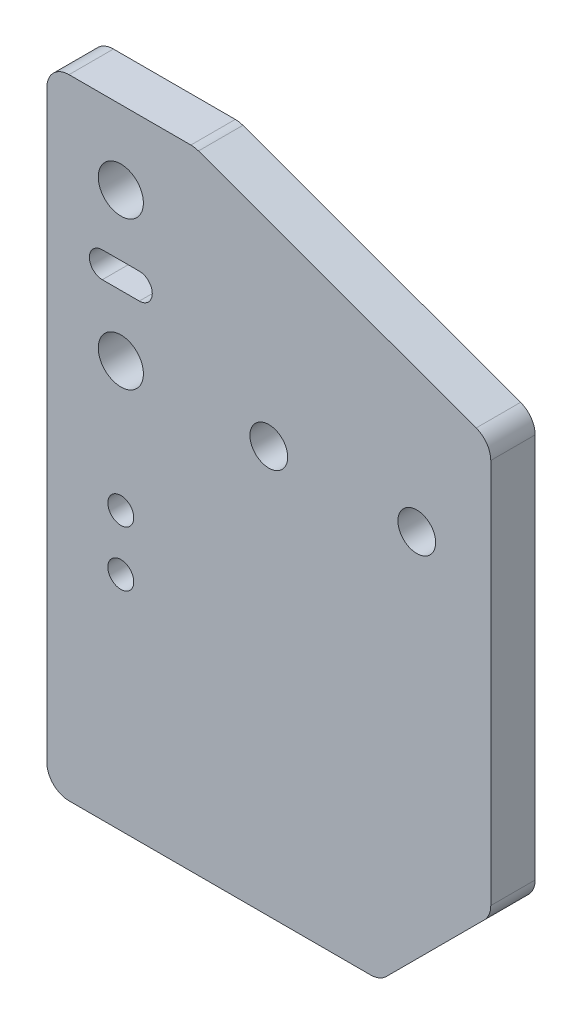
from build123d import *

# Parameters (mm, degrees)
MODEL_R         = 3.05
MODEL_R_2       = 2.55
BODY_DEPTH      = 6
SKETCH1_R       = 1.75
FORSENSOR_DEPTH = 10


with BuildPart() as part:
    # Model → Body (new body)
    with BuildSketch(Plane.XY):
        with BuildLine():
            Line((59.121320344, 14.121320344), (45.878679656, 0.878679656))
            ThreePointArc((45.878679656, 0.878679656), (44.90540961, 0.228361402), (43.757359313, 0))
            Line((43.757359313, 0), (3, 0))
            ThreePointArc((3, 0), (0.878679656, 0.878679656), (0, 3))
            Line((0, 3), (0, 82))
            ThreePointArc((0, 82), (0.878679656, 84.121320344), (3, 85))
            Line((3, 85), (19.471019058, 85))
            ThreePointArc((19.471019058, 85), (19.991963591, 84.954423259), (20.497079488, 84.819077862))
            Line((20.497079488, 84.819077862), (58.02606043, 71.159645877))
            ThreePointArc((58.02606043, 71.159645877), (59.457456133, 70.061297324), (60, 68.340568015))
            Line((60, 68.340568015), (60, 16.242640687))
            ThreePointArc((60, 16.242640687), (59.771638598, 15.09459039), (59.121320344, 14.121320344))
        make_face()
        with Locations((10, 75)):
            Circle(MODEL_R, mode=Mode.SUBTRACT)
        with Locations((10, 55)):
            Circle(MODEL_R, mode=Mode.SUBTRACT)
        with Locations((30, 55)):
            Circle(MODEL_R_2, mode=Mode.SUBTRACT)
        with Locations((50, 55)):
            Circle(MODEL_R_2, mode=Mode.SUBTRACT)
        with BuildLine():
            Line((12.5, 63.25), (7.5, 63.25))
            ThreePointArc((7.5, 63.25), (5.75, 65), (7.5, 66.75))
            Line((7.5, 66.75), (12.5, 66.75))
            ThreePointArc((12.5, 66.75), (14.25, 65), (12.5, 63.25))
        make_face(mode=Mode.SUBTRACT)
    extrude(amount=BODY_DEPTH)

    # Sketch1 → ForSensor (cut)
    with BuildSketch(Plane(origin=(0, 0, 0), x_dir=(-1, 0, 0), z_dir=(0, 0, -1))):
        with Locations((-10, 30)):
            Circle(SKETCH1_R)
        with Locations((-10, 37.5)):
            Circle(SKETCH1_R)
    extrude(amount=-FORSENSOR_DEPTH, mode=Mode.SUBTRACT)


solid = part.part
